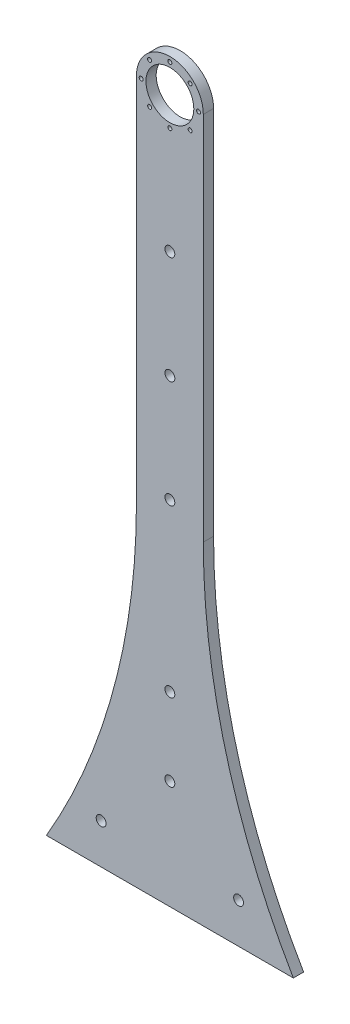
from build123d import *

# Parameters (mm, degrees)
SKETCH2_R           = 12.6
BOSS_EXTRUDE1_DEPTH = 5.4
SKETCH3_R           = 1.05
SKETCH3_R_2         = 2.6
CUT_EXTRUDE1_DEPTH  = 413.785561763


with BuildPart() as part:
    # Sketch2 → Boss-Extrude1 (new body)
    with BuildSketch(Plane.XY):
        with BuildLine():
            Line((-17.6, 390), (-17.6, 195))
            ThreePointArc((-17.6, 195), (-29.659714989, 104.34714566), (-65, 20))
            Line((-65, 20), (65, 20))
            ThreePointArc((65, 20), (29.659714989, 104.34714566), (17.6, 195))
            Line((17.6, 195), (17.6, 390))
            ThreePointArc((17.6, 390), (0, 407.6), (-17.6, 390))
        make_face()
        with Locations((0, 390)):
            Circle(SKETCH2_R, mode=Mode.SUBTRACT)
    extrude(amount=-BOSS_EXTRUDE1_DEPTH)

    # Sketch3 → Cut-Extrude1 (cut, through all)
    with BuildSketch(Plane(origin=(0, 0, -5.4), x_dir=(-1, 0, 0), z_dir=(0, 0, -1))):
        with Locations((0, 405.1)):
            Circle(SKETCH3_R)
        with Locations((10.677312396, 400.677312396)):
            Circle(SKETCH3_R)
        with Locations((15.1, 390)):
            Circle(SKETCH3_R)
        with Locations((10.677312396, 379.322687604)):
            Circle(SKETCH3_R)
        with Locations((0, 374.9)):
            Circle(SKETCH3_R)
        with Locations((-10.677312396, 379.322687604)):
            Circle(SKETCH3_R)
        with Locations((-15.1, 390)):
            Circle(SKETCH3_R)
        with Locations((-10.677312396, 400.677312396)):
            Circle(SKETCH3_R)
        with Locations((0, 318.7)):
            Circle(SKETCH3_R_2)
        with Locations((0, 262.1)):
            Circle(SKETCH3_R_2)
        with Locations((0, 205.5)):
            Circle(SKETCH3_R_2)
        with Locations((0, 117.98239975)):
            Circle(SKETCH3_R_2)
        with Locations((0, 77.262384832)):
            Circle(SKETCH3_R_2)
        with Locations((36.174923221, 41.087461611)):
            Circle(SKETCH3_R_2)
        with Locations((-36.174923221, 41.087461611)):
            Circle(SKETCH3_R_2)
    extrude(amount=-CUT_EXTRUDE1_DEPTH, mode=Mode.SUBTRACT)


solid = part.part
